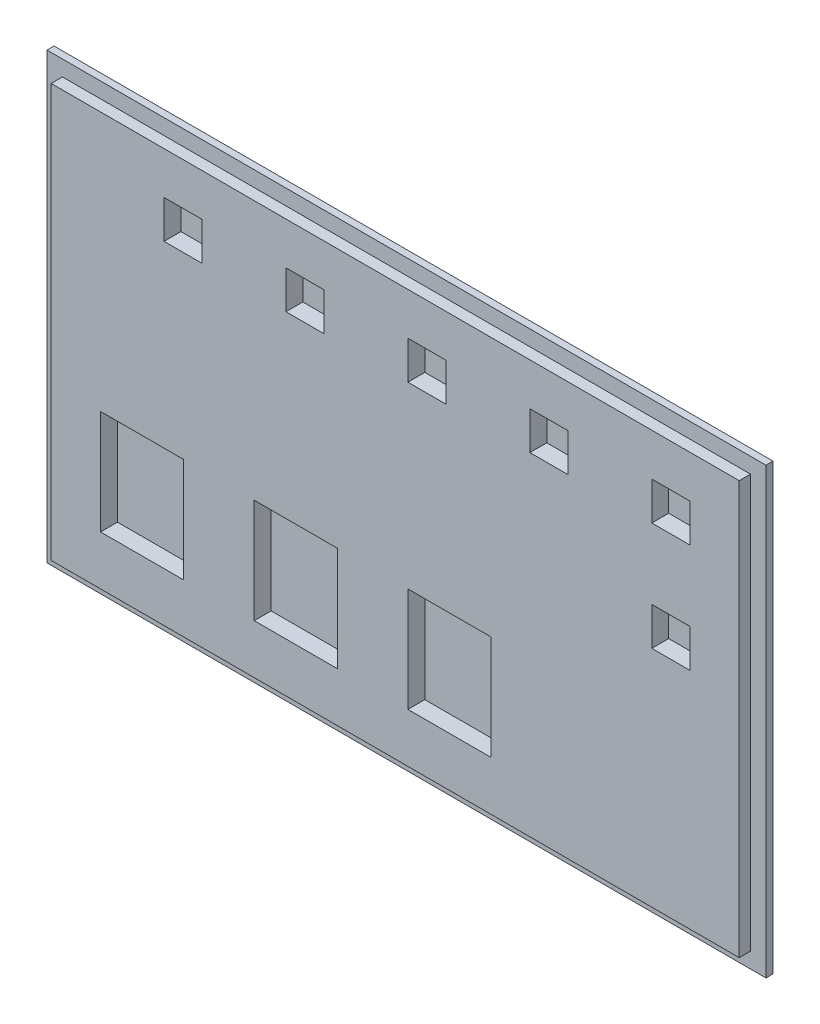
from build123d import *

# Parameters (mm, degrees)
SKICA1_W                = 97.6
SKICA1_H                = 58.6
SKICA1_W_2              = 11.8
SKICA1_H_2              = 14.8
SKICA1_W_3              = 5.4
SKICA1_H_3              = 5.4
P_IDAT_VYSUNUT_M1_DEPTH = 2.6
SKICA1_3_W              = 102
SKICA1_3_H              = 63
SKICA1_3_W_2            = 97.6
SKICA1_3_H_2            = 58.6
P_IDAT_VYSUNUT_M2_DEPTH = 1
SKICA1_5_W              = 5.4
SKICA1_5_H              = 5.4
SKICA1_5_W_2            = 11.8
SKICA1_5_H_2            = 14.8
P_IDAT_VYSUNUT_M3_DEPTH = 0.2


with BuildPart() as part:
    # Skica1 → Přidat vysunutím1 (new body)
    with BuildSketch(Plane.XY):
        with Locations((51, 31.5)):
            Rectangle(SKICA1_W, SKICA1_H)
        with Locations((15.1, 16.6)):
            Rectangle(SKICA1_W_2, SKICA1_H_2, mode=Mode.SUBTRACT)
        with Locations((36.9, 16.6)):
            Rectangle(SKICA1_W_2, SKICA1_H_2, mode=Mode.SUBTRACT)
        with Locations((58.7, 16.6)):
            Rectangle(SKICA1_W_2, SKICA1_H_2, mode=Mode.SUBTRACT)
        with Locations((20.9, 52.1)):
            Rectangle(SKICA1_W_3, SKICA1_H_3, mode=Mode.SUBTRACT)
        with Locations((38.2, 52.1)):
            Rectangle(SKICA1_W_3, SKICA1_H_3, mode=Mode.SUBTRACT)
        with Locations((90.1, 36.7)):
            Rectangle(SKICA1_W_3, SKICA1_H_3, mode=Mode.SUBTRACT)
        with Locations((55.5, 52.1)):
            Rectangle(SKICA1_W_3, SKICA1_H_3, mode=Mode.SUBTRACT)
        with Locations((72.8, 52.1)):
            Rectangle(SKICA1_W_3, SKICA1_H_3, mode=Mode.SUBTRACT)
        with Locations((90.1, 52.1)):
            Rectangle(SKICA1_W_3, SKICA1_H_3, mode=Mode.SUBTRACT)
    extrude(amount=P_IDAT_VYSUNUT_M1_DEPTH)

    # Skica1<3> → Přidat vysunutím2 (add)
    with BuildSketch(Plane.XY):
        with Locations((51, 31.5)):
            Rectangle(SKICA1_3_W, SKICA1_3_H)
        with Locations((51, 31.5)):
            Rectangle(SKICA1_3_W_2, SKICA1_3_H_2, mode=Mode.SUBTRACT)
    extrude(amount=P_IDAT_VYSUNUT_M2_DEPTH)

    # Skica1<5> → Přidat vysunutím3 (add)
    with BuildSketch(Plane.XY):
        with Locations((20.9, 52.1)):
            Rectangle(SKICA1_5_W, SKICA1_5_H)
        with Locations((38.2, 52.1)):
            Rectangle(SKICA1_5_W, SKICA1_5_H)
        with Locations((55.5, 52.1)):
            Rectangle(SKICA1_5_W, SKICA1_5_H)
        with Locations((72.8, 52.1)):
            Rectangle(SKICA1_5_W, SKICA1_5_H)
        with Locations((90.1, 52.1)):
            Rectangle(SKICA1_5_W, SKICA1_5_H)
        with Locations((15.1, 16.6)):
            Rectangle(SKICA1_5_W_2, SKICA1_5_H_2)
        with Locations((36.9, 16.6)):
            Rectangle(SKICA1_5_W_2, SKICA1_5_H_2)
        with Locations((58.7, 16.6)):
            Rectangle(SKICA1_5_W_2, SKICA1_5_H_2)
        with Locations((90.1, 36.7)):
            Rectangle(SKICA1_5_W, SKICA1_5_H)
    extrude(amount=P_IDAT_VYSUNUT_M3_DEPTH)


solid = part.part
